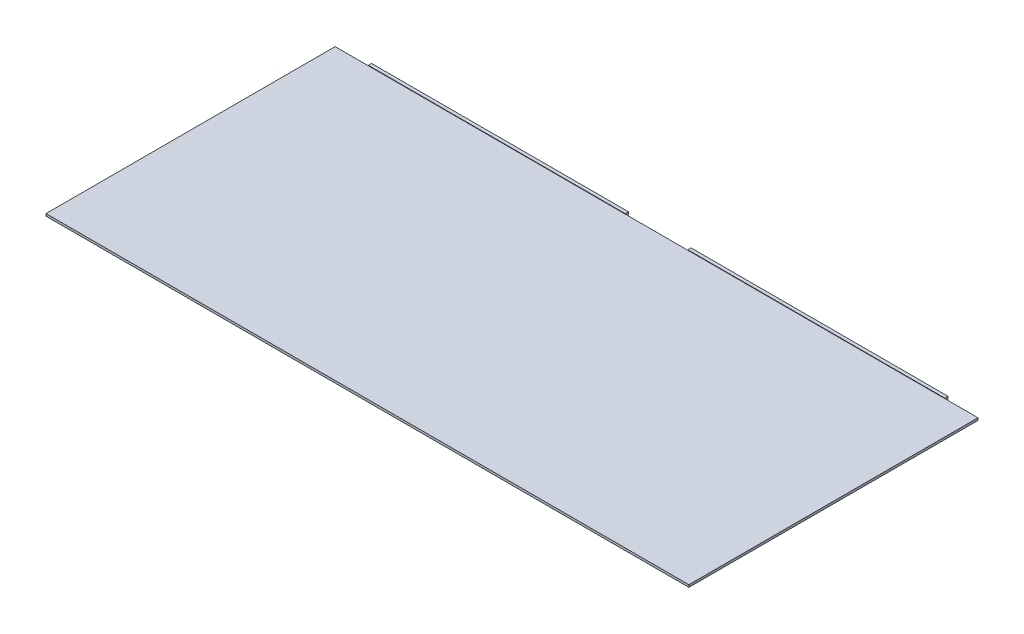
from build123d import *

# Parameters (mm, degrees)
SKETCH1_W           = 635.3556
SKETCH1_H           = 285.75
BOSS_EXTRUDE1_DEPTH = 1.143
SKETCH2_W           = 254
SKETCH2_H           = 2.7305
BOSS_EXTRUDE2_DEPTH = 3.175


with BuildPart() as part:
    # Sketch1 → Boss-Extrude1 (new, symmetric)
    with BuildSketch(Plane(origin=(0, 0, 0), x_dir=(1, 0, 0), z_dir=(0, 1, 0))):
        Rectangle(SKETCH1_W, SKETCH1_H)
    extrude(amount=BOSS_EXTRUDE1_DEPTH, both=True)

    # Sketch2 → Boss-Extrude2 (add)
    with BuildSketch(Plane(origin=(0, 0, -142.875), x_dir=(-1, 0, 0), z_dir=(0, 0, -1))):
        with Locations((-157.8229, 0.22225)):
            Rectangle(SKETCH2_W, SKETCH2_H)
        with Locations((157.8229, 0.22225)):
            Rectangle(SKETCH2_W, SKETCH2_H)
    extrude(amount=BOSS_EXTRUDE2_DEPTH)


solid = part.part
